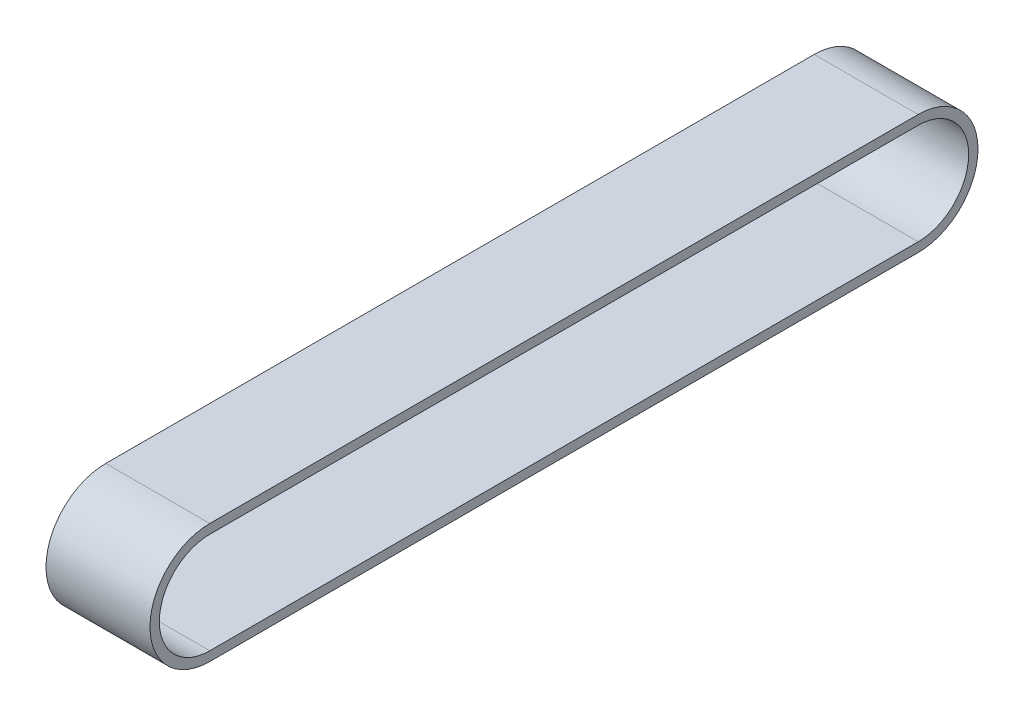
from build123d import *

# Parameters (mm, degrees)
BOSS_EXTRUDE1_DEPTH = 12.7


with BuildPart() as part:
    # Sketch1 → Boss-Extrude1 (new, symmetric)
    with BuildSketch(Plane(origin=(0, 0, 0), x_dir=(0, 0, -1), z_dir=(1, 0, 0))):
        with BuildLine():
            Line((-86.51875, 14.605), (86.51875, 14.605))
            ThreePointArc((86.51875, 14.605), (101.12375, 0), (86.51875, -14.605))
            Line((86.51875, -14.605), (-86.51875, -14.605))
            ThreePointArc((-86.51875, -14.605), (-101.12375, 0), (-86.51875, 14.605))
        make_face()
        with BuildLine():
            Line((-86.51875, 12.319), (86.51875, 12.319))
            ThreePointArc((86.51875, 12.319), (98.83775, 0), (86.51875, -12.319))
            Line((86.51875, -12.319), (-86.51875, -12.319))
            ThreePointArc((-86.51875, -12.319), (-98.83775, 0), (-86.51875, 12.319))
        make_face(mode=Mode.SUBTRACT)
    extrude(amount=BOSS_EXTRUDE1_DEPTH, both=True)


solid = part.part
